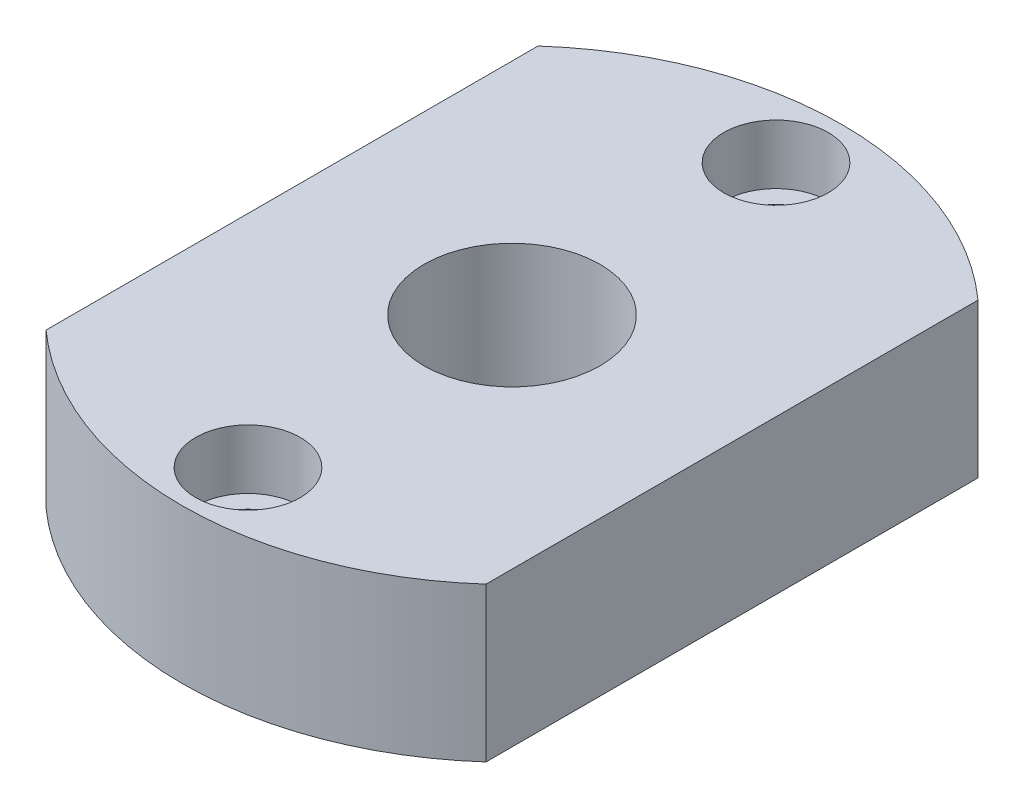
from build123d import *

# Parameters (mm, degrees)
SKETCH_1_R           = 30
EXTRUDE_1_DEPTH      = 14
SKETCH_2_R           = 8
CUT_EXTRUDE_1_DEPTH  = 14
SKETCH_3_R           = 3
CUT_EXTRUDE_2_DEPTH  = 14
SKETCH_4_R           = 4.75
CUT_EXTRUDE_3_DEPTH  = 5.4
SKETCH_5_OUTSIDE_W   = 79.2
SKETCH_5_OUTSIDE_H   = 79.2
SKETCH_5_OUTSIDE_W_2 = 40
SKETCH_5_OUTSIDE_H_2 = 65
CUT_EXTRUDE_4_DEPTH  = 14


with BuildPart() as part:
    # 草图1 → 凸台-拉伸1 (new body)
    with BuildSketch(Plane(origin=(0, 0, 0), x_dir=(1, 0, 0), z_dir=(0, 1, 0))):
        Circle(SKETCH_1_R)
    extrude(amount=EXTRUDE_1_DEPTH)

    # 草图2 → 切除-拉伸1 (cut)
    with BuildSketch(Plane(origin=(0, 14, 0), x_dir=(1, 0, 0), z_dir=(0, 1, 0))):
        Circle(SKETCH_2_R)
    extrude(amount=-CUT_EXTRUDE_1_DEPTH, mode=Mode.SUBTRACT)

    # 草图3 → 切除-拉伸2 (cut)
    with BuildSketch(Plane(origin=(0, 14, 0), x_dir=(1, 0, 0), z_dir=(0, 1, 0))):
        with Locations((0, 24)):
            Circle(SKETCH_3_R)
        with Locations((0, -24)):
            Circle(SKETCH_3_R)
    extrude(amount=-CUT_EXTRUDE_2_DEPTH, mode=Mode.SUBTRACT)

    # 草图4 → 切除-拉伸3 (cut)
    with BuildSketch(Plane(origin=(0, 14, 0), x_dir=(1, 0, 0), z_dir=(0, 1, 0))):
        with Locations((0, 24)):
            Circle(SKETCH_4_R)
        with Locations((0, -24)):
            Circle(SKETCH_4_R)
    extrude(amount=-CUT_EXTRUDE_3_DEPTH, mode=Mode.SUBTRACT)

    # 草图5 outside → 切除-拉伸4 (cut)
    with BuildSketch(Plane(origin=(0, 14, 0), x_dir=(1, 0, 0), z_dir=(0, 1, 0))):
        Rectangle(SKETCH_5_OUTSIDE_W, SKETCH_5_OUTSIDE_H)
        Rectangle(SKETCH_5_OUTSIDE_W_2, SKETCH_5_OUTSIDE_H_2, mode=Mode.SUBTRACT)
    extrude(amount=-CUT_EXTRUDE_4_DEPTH, mode=Mode.SUBTRACT)


solid = part.part
